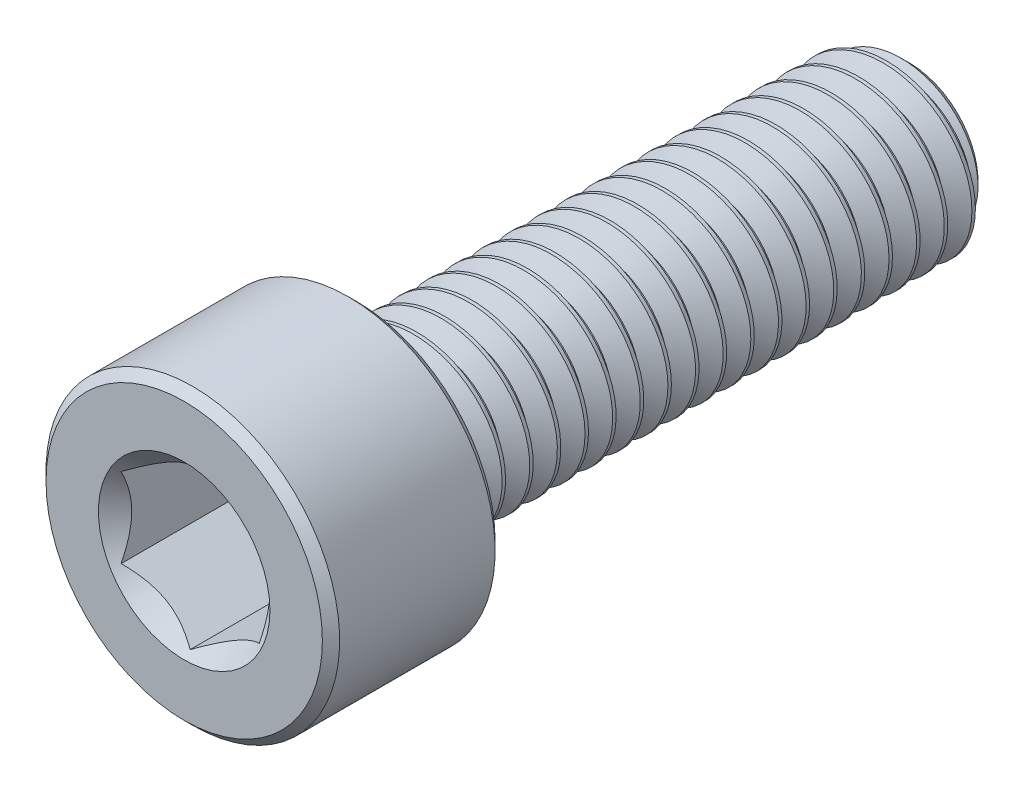
from build123d import *

# Parameters (mm, degrees)
CUT_EXTRUDE1_DEPTH     = 4
SPLIT1_SURFACE_1_BACK  = 25.197
SPLIT1_SURFACE_1_DEPTH = 50.394
SPLIT1_SURFACE_2_BACK  = 25.197
SPLIT1_SURFACE_2_DEPTH = 50.394
CUT_SWEEP1_PITCH       = 0.8
CUT_SWEEP1_TO          = 15.75


with BuildPart() as part:
    # Sketch2 → Revolve1 (revolve)
    with BuildSketch(Plane(origin=(0, 0, 0), x_dir=(0, 0, -1), z_dir=(1, 0, 0))):
        with BuildLine():
            Line((-10.5, 0), (-10.5, 4))
            Line((-10.5, 4), (-10.25, 4.25))
            Line((-10.25, 4.25), (-5.75, 4.25))
            Line((-5.75, 4.25), (-5.5, 4))
            Line((-5.5, 4), (-5.5, 2.75))
            ThreePointArc((-5.5, 2.75), (-5.426776695, 2.573223305), (-5.25, 2.5))
            Line((-5.25, 2.5), (9.980384758, 2.5))
            Line((9.980384758, 2.5), (10.5, 1.980384758))
            Line((10.5, 1.980384758), (10.5, 0))
            Line((10.5, 0), (-10.5, 0))
        make_face()
    revolve(axis=Axis((0, 0, -10.5), (0, 0, 1)))

    # Sketch3 → Cut-Extrude1 (cut)
    with BuildSketch(Plane.XY.offset(10.5)):
        Polygon((2, -1.154700538), (2, 1.154700538), (0, 2.309401077), (-2, 1.154700538), (-2, -1.154700538), (0, -2.309401077), align=None)
    extrude(amount=-CUT_EXTRUDE1_DEPTH, mode=Mode.SUBTRACT)

    # Cut-Extrude2 cone 1 section (through the dimple's axis) → Cut-Extrude2 (revolve, cut)
    with BuildSketch(Plane(origin=(0, 0, 10.5), x_dir=(0, -1, 0), z_dir=(1, 0, 0))):
        Polygon((0, 0), (2.482606158, 0), (0, 2.482606158), align=None)
    revolve(axis=Axis((0, 0, 10.5), (0, 0, -1)), mode=Mode.SUBTRACT)


with BuildPart() as body_2:
    # Split1: the piece behind the surface
    add(part.part)
    # Split1 surface: a surface, the sketch's curves swept straight by 50.394 mm
    with BuildLine(Plane(origin=(0, 0, 0), x_dir=(0, 0, -1), z_dir=(1, 0, 0)).offset(-SPLIT1_SURFACE_1_BACK), mode=Mode.PRIVATE) as split1_surface_1_path:
        Line((-5.25, -4.25), (-5.25, 4.25))
    split1_surface_1 = Shell.extrude(split1_surface_1_path.wire(), (1 * SPLIT1_SURFACE_1_DEPTH, 0 * SPLIT1_SURFACE_1_DEPTH, 0 * SPLIT1_SURFACE_1_DEPTH))
    split(bisect_by=split1_surface_1, keep=Keep.BOTTOM)

    # Cut-Sweep1: arcs per turn and ends read off the stored shape
    # Cut-Sweep1: the profile of Sketch7 screwed along a right-hand helix through 21 turns, 8 arcs to a turn; built about Z, then put on its axis
    cut_sweep1_z = Axis((0, 0, 0), (0, 0, 1))
    cut_sweep1_corners = [(2.54330127, 0, 0.025), (2.54330127, 0, -0.725), (1.980384758, 0, -0.4), (1.980384758, 0, -0.3)]
    with BuildLine(mode=Mode.PRIVATE) as cut_sweep1_profile:
        Line(cut_sweep1_corners[0], cut_sweep1_corners[1])
        Line(cut_sweep1_corners[1], cut_sweep1_corners[2])
        Line(cut_sweep1_corners[2], cut_sweep1_corners[3])
        Line(cut_sweep1_corners[3], cut_sweep1_corners[0])
    cut_sweep1_cap = Face(cut_sweep1_profile.wire())
    cut_sweep1_turn_angles = [0, 22.5, 45, 67.5, 90, 112.5, 135, 157.5, 180, 202.5, 225, 247.5, 270, 292.5, 315, 337.5, 360]
    cut_sweep1_turn_weights = [1, 0.9238795325112867, 1, 0.9238795325112867, 1, 0.9238795325112867, 1, 0.9238795325112867, 1, 0.9238795325112867, 1, 0.9238795325112867, 1, 0.9238795325112867, 1, 0.9238795325112867, 1]
    cut_sweep1_turn_rails = [Edge.make_bspline([Vector(p[0], p[1], 0).rotate(cut_sweep1_z, cut_sweep1_turn_angles[k]) / cut_sweep1_turn_weights[k] + Vector(0, 0, p[2] + CUT_SWEEP1_PITCH * cut_sweep1_turn_angles[k] / 360) for k in range(17)], [0, 0, 0, 1, 1, 2, 2, 3, 3, 4, 4, 5, 5, 6, 6, 7, 7, 8, 8, 8], 2, cut_sweep1_turn_weights) for p in cut_sweep1_corners]
    cut_sweep1_turn_sides = [Face.make_surface_from_curves(cut_sweep1_turn_rails[p[0]], cut_sweep1_turn_rails[p[1]]) for p in [(0, 1), (1, 2), (2, 3), (3, 0)]]
    cut_sweep1 = Plane(origin=(0, 0, -10.5), x_dir=(0, 1, 0), z_dir=(0, 0, 1)) * split(Solid(Shell([*[p.moved(Location((0, 0, CUT_SWEEP1_PITCH * i))) for i in range(21) for p in cut_sweep1_turn_sides], cut_sweep1_cap, cut_sweep1_cap.rotate(cut_sweep1_z, 7560).moved(Location((0, 0, CUT_SWEEP1_PITCH * 7560 / 360)))])), bisect_by=Plane.XY.offset(CUT_SWEEP1_TO), keep=Keep.BOTTOM, mode=Mode.PRIVATE)
    add(cut_sweep1, mode=Mode.SUBTRACT)


with BuildPart() as part_1:
    add(part.part)

    # Split1: split by a surface, the side it looks to stays
    # Split1 surface: a surface, the sketch's curves swept straight by 50.394 mm
    with BuildLine(Plane(origin=(0, 0, 0), x_dir=(0, 0, -1), z_dir=(1, 0, 0)).offset(-SPLIT1_SURFACE_2_BACK), mode=Mode.PRIVATE) as split1_surface_2_path:
        Line((-5.25, -4.25), (-5.25, 4.25))
    split1_surface_2 = Shell.extrude(split1_surface_2_path.wire(), (1 * SPLIT1_SURFACE_2_DEPTH, 0 * SPLIT1_SURFACE_2_DEPTH, 0 * SPLIT1_SURFACE_2_DEPTH))
    split(bisect_by=split1_surface_2, keep=Keep.TOP)

    add(body_2.part)  # Revolve2 merges body 2
    # Sketch8 → Revolve2 (revolve)
    with BuildSketch(Plane(origin=(0, 0, 0), x_dir=(0, 0, -1), z_dir=(1, 0, 0)), mode=Mode.PRIVATE) as revolve2_sk:
        Polygon((-5.5, 0), (-5.5, 2.5), (-5.25, 2.5), (-3.806624327, 0), align=None)
    revolve(revolve2_sk.sketch.rotate(Axis((0, 0, 3.806624327), (0, 0, 1)), 270), axis=Axis((0, 0, 3.806624327), (0, 0, 1)))


solid = part_1.part
